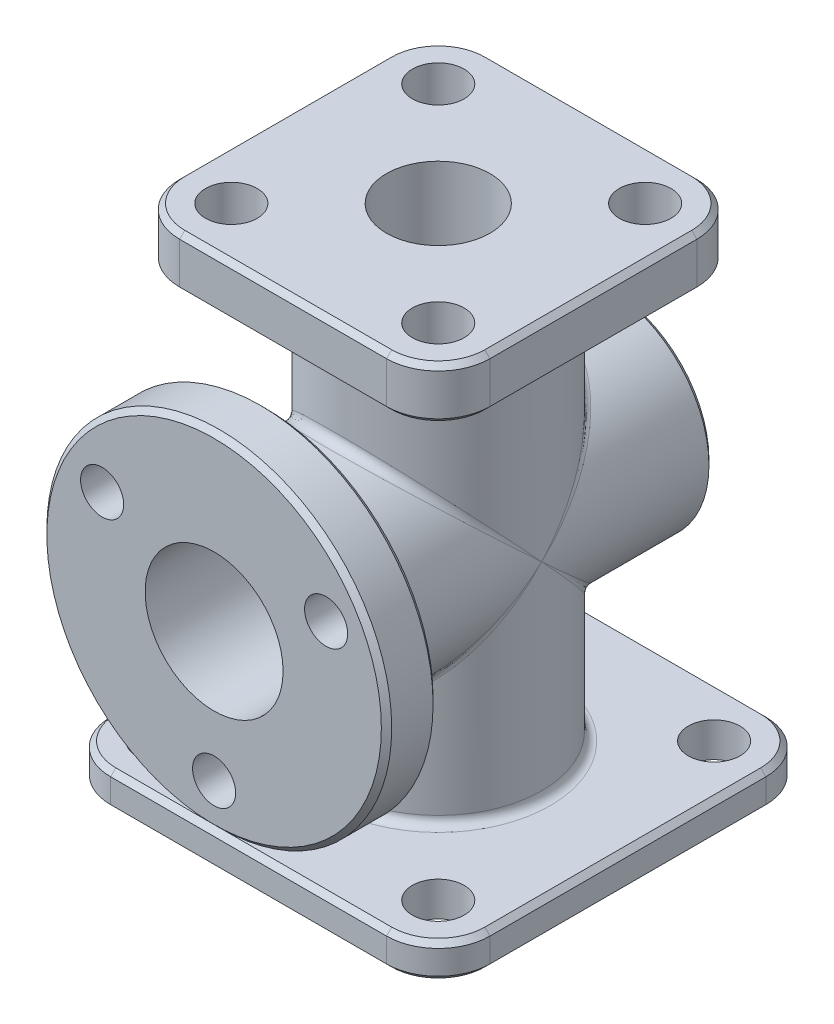
from build123d import *

# Parameters (mm, degrees)
SKETCH1_R           = 1.5
BOSS_EXTRUDE1_DEPTH = 3
SKETCH2_R           = 6
BOSS_EXTRUDE2_DEPTH = 24
SKETCH3_R           = 1.5
BOSS_EXTRUDE3_DEPTH = 2
SKETCH4_R           = 3
CUT_EXTRUDE1_DEPTH  = 33.908965344
CHAMFER1_SIZE       = 3
SKETCH5_R           = 6
BOSS_EXTRUDE4_DEPTH = 10
SKETCH6_R           = 10
SKETCH6_R_2         = 1.25
BOSS_EXTRUDE5_DEPTH = 3
SKETCH7_R           = 4
CUT_EXTRUDE2_DEPTH  = 19
SKETCH8_R           = 1.5
CUT_EXTRUDE3_DEPTH  = 37.414282912
FILLET1_R           = 0.5
CHAMFER2_SIZE       = 0.3


with BuildPart() as part:
    # Sketch1 → Boss-Extrude1 (new body)
    with BuildSketch(Plane(origin=(0, 0, 0), x_dir=(1, 0, 0), z_dir=(0, 1, 0))):
        with BuildLine():
            Line((6, -9), (-6, -9))
            ThreePointArc((-6, -9), (-8.121320344, -8.121320344), (-9, -6))
            Line((-9, -6), (-9, 6))
            ThreePointArc((-9, 6), (-8.121320344, 8.121320344), (-6, 9))
            Line((-6, 9), (6, 9))
            ThreePointArc((6, 9), (8.121320344, 8.121320344), (9, 6))
            Line((9, 6), (9, -6))
            ThreePointArc((9, -6), (8.121320344, -8.121320344), (6, -9))
        make_face()
        with Locations(Location((-6, 6, 0), (0, 0, 270))):
            Circle(SKETCH1_R, mode=Mode.SUBTRACT)
        with Locations(Location((6, 6, 0), (0, 0, 270))):
            Circle(SKETCH1_R, mode=Mode.SUBTRACT)
        with Locations(Location((6, -6, 0), (0, 0, 270))):
            Circle(SKETCH1_R, mode=Mode.SUBTRACT)
        with Locations(Location((-6, -6, 0), (0, 0, 270))):
            Circle(SKETCH1_R, mode=Mode.SUBTRACT)
    extrude(amount=BOSS_EXTRUDE1_DEPTH)

    # Sketch2 → Boss-Extrude2 (add)
    with BuildSketch(Plane(origin=(0, 0, 0), x_dir=(1, 0, 0), z_dir=(0, 1, 0))):
        with Locations(Location((0, 0, 0), (0, 0, 270))):
            Circle(SKETCH2_R)
    extrude(amount=-BOSS_EXTRUDE2_DEPTH)

    # Sketch3 → Boss-Extrude3 (add)
    with BuildSketch(Plane.XZ.offset(24)):
        with BuildLine():
            Line((8, -11), (-8, -11))
            ThreePointArc((-8, -11), (-10.121320344, -10.121320344), (-11, -8))
            Line((-11, -8), (-11, 8))
            ThreePointArc((-11, 8), (-10.121320344, 10.121320344), (-8, 11))
            Line((-8, 11), (8, 11))
            ThreePointArc((8, 11), (10.121320344, 10.121320344), (11, 8))
            Line((11, 8), (11, -8))
            ThreePointArc((11, -8), (10.121320344, -10.121320344), (8, -11))
        make_face()
        with Locations(Location((-8, 8, 0), (0, 0, 270))):
            Circle(SKETCH3_R, mode=Mode.SUBTRACT)
        with Locations(Location((8, 8, 0), (0, 0, 270))):
            Circle(SKETCH3_R, mode=Mode.SUBTRACT)
        with Locations(Location((8, -8, 0), (0, 0, 270))):
            Circle(SKETCH3_R, mode=Mode.SUBTRACT)
        with Locations(Location((-8, -8, 0), (0, 0, 270))):
            Circle(SKETCH3_R, mode=Mode.SUBTRACT)
    extrude(amount=BOSS_EXTRUDE3_DEPTH)

    # Sketch4 → Cut-Extrude1 (cut, through all)
    with BuildSketch(Plane(origin=(0, 3, 0), x_dir=(1, 0, 0), z_dir=(0, 1, 0))):
        with Locations(Location((0, 0, 0), (0, 0, 270))):
            Circle(SKETCH4_R)
    extrude(amount=-CUT_EXTRUDE1_DEPTH, mode=Mode.SUBTRACT)

    # Chamfer1
    chamfer1_edges = [part.edges().sort_by_distance(p)[0] for p in [
        (0, -26, -3),
    ]]
    chamfer(chamfer1_edges, length=CHAMFER1_SIZE)

    # Sketch5 → Boss-Extrude4 (add, symmetric)
    with BuildSketch(Plane.XY):
        with Locations((0, -12)):
            Circle(SKETCH5_R)
    extrude(amount=BOSS_EXTRUDE4_DEPTH, both=True)

    # Sketch6 → Boss-Extrude5 (add)
    with BuildSketch(Plane.XY.offset(10)):
        with Locations((0, -12)):
            Circle(SKETCH6_R)
        with Locations((-6.495190528, -8.25)):
            Circle(SKETCH6_R_2, mode=Mode.SUBTRACT)
        with Locations((6.495190528, -8.25)):
            Circle(SKETCH6_R_2, mode=Mode.SUBTRACT)
        with Locations((0, -19.5)):
            Circle(SKETCH6_R_2, mode=Mode.SUBTRACT)
    extrude(amount=BOSS_EXTRUDE5_DEPTH)

    # Sketch7 → Cut-Extrude2 (cut)
    with BuildSketch(Plane.XY.offset(13)):
        with Locations((0, -12)):
            Circle(SKETCH7_R)
    extrude(amount=-CUT_EXTRUDE2_DEPTH, mode=Mode.SUBTRACT)

    # Sketch8 → Cut-Extrude3 (cut, through all)
    with BuildSketch(Plane(origin=(0, 0, -10), x_dir=(-1, 0, 0), z_dir=(0, 0, -1))):
        with Locations((0, -12)):
            Circle(SKETCH8_R)
    extrude(amount=-CUT_EXTRUDE3_DEPTH, mode=Mode.SUBTRACT)

    # Fillet1
    fillet1_edges = [part.edges().sort_by_distance(p)[0] for p in [
        (0, 0, -6),
        (0, -24, -6),
        (4.579776101, -15.876293445, 3.876293445),
        (-6.612e-06, -18, -6),
        (-4.579776101, -8.123706555, -3.876293445),
        (4.579776101, -8.123706555, 3.876293445),
    ]]
    fillet(fillet1_edges, radius=FILLET1_R)

    # Chamfer2
    chamfer2_edges = [part.edges().sort_by_distance(p)[0] for p in [
        (-10, -12, 13),
        (0, 0, -9),
        (-10, -12, 10),
        (8.121320344, 0, -8.121320344),
        (9, 0, 0),
        (8.121320344, 0, 8.121320344),
        (8.121320344, 3, -8.121320344),
        (0, 3, -9),
        (-8.121320344, 3, -8.121320344),
        (-9, 3, 0),
        (-8.121320344, 3, 8.121320344),
        (0, 3, 9),
        (10.121320344, -26, -10.121320344),
        (11, -26, 0),
        (10.121320344, -26, 10.121320344),
        (0, -26, 11),
        (-10.121320344, -26, 10.121320344),
        (-11, -26, 0),
        (-10.121320344, -26, -10.121320344),
        (0, -26, -11),
        (8.121320344, 3, 8.121320344),
        (10.121320344, -24, -10.121320344),
        (11, -24, 0),
        (10.121320344, -24, 10.121320344),
        (0, -24, 11),
        (-10.121320344, -24, 10.121320344),
        (-11, -24, 0),
        (-10.121320344, -24, -10.121320344),
        (0, -24, -11),
        (0, 0, 9),
        (-6, -12, -10),
        (9, 3, 0),
        (-8.121320344, 0, 8.121320344),
        (-9, 0, 0),
        (-8.121320344, 0, -8.121320344),
    ]]
    chamfer(chamfer2_edges, length=CHAMFER2_SIZE)


solid = part.part
